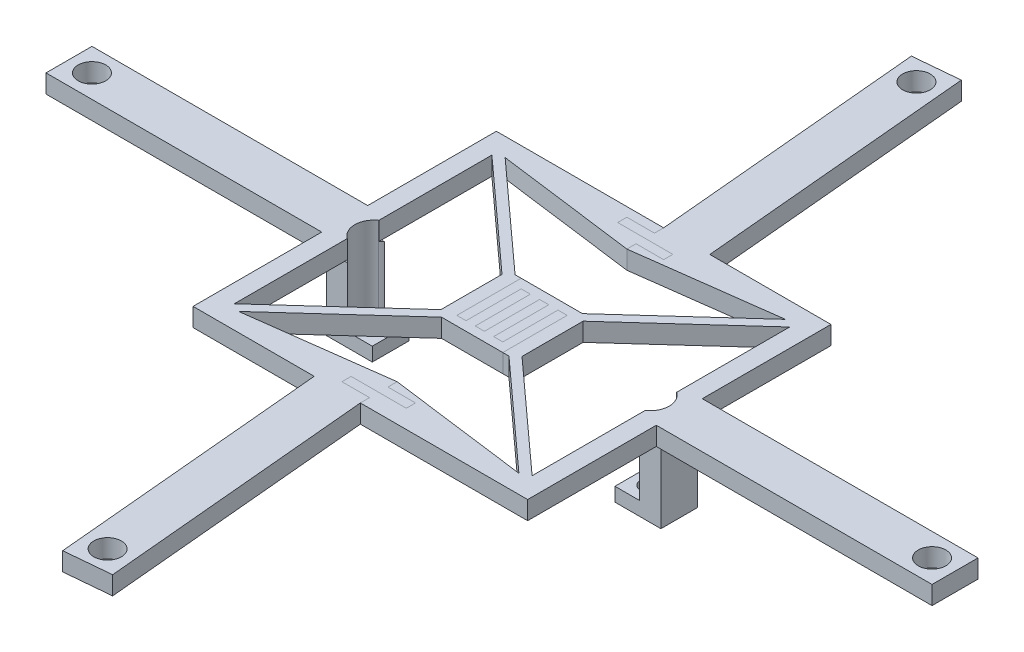
from build123d import *

# Parameters (mm, degrees)
SKETCH1_W           = 36.4
SKETCH1_H           = 33
BOSS_EXTRUDE1_DEPTH = 2
SKETCH2_W           = 5
SKETCH2_H           = 4
BOSS_EXTRUDE2_DEPTH = 8
SKETCH4_R           = 1
CUT_EXTRUDE2_DEPTH  = 27.162759793
CUT_EXTRUDE1_DEPTH  = 8.5
SKETCH5_W           = 2.5
SKETCH5_H           = 2
BOSS_EXTRUDE3_DEPTH = 30
SKETCH6_W           = 2.5
SKETCH6_H           = 2
BOSS_EXTRUDE4_DEPTH = 30
SKETCH11_R          = 1.5
CUT_EXTRUDE3_DEPTH  = 52.918108594
SKETCH10_R          = 1.5
BOSS_EXTRUDE5_DEPTH = 2
SPLIT2_START        = -16.5
SPLIT2_DEPTH        = 58.9999999
SPLIT2_START_2      = 16.5
SPLIT2_2_OUTLINE_W  = 6
SPLIT2_2_OUTLINE_H  = 2
SPLIT2_2_DEPTH      = 30.113981094
SPLIT2_START_3      = -3
SPLIT2_3_OUTLINE_W  = 1
SPLIT2_3_OUTLINE_H  = 2
SPLIT2_3_DEPTH      = 7
SPLIT2_START_4      = 3
SPLIT2_4_OUTLINE_W  = 3
SPLIT2_4_OUTLINE_H  = 2
SPLIT2_4_DEPTH      = 11.5
SPLIT2_START_5      = -14.5
SPLIT2_5_OUTLINE_W  = 6
SPLIT2_5_OUTLINE_H  = 2
SPLIT2_5_DEPTH      = 1
SPLIT2_6_OUTLINE_W  = 3
SPLIT2_6_OUTLINE_H  = 2
SPLIT2_6_DEPTH      = 1
SPLIT2_START_6      = -13.5
SPLIT2_7_OUTLINE_W  = 3
SPLIT2_7_OUTLINE_H  = 2
SPLIT2_7_DEPTH      = 1
SPLIT2_START_7      = 13.5
SPLIT2_8_OUTLINE_W  = 3
SPLIT2_8_OUTLINE_H  = 2
SPLIT2_8_DEPTH      = 1
SPLIT2_START_8      = 15.5
SPLIT2_9_OUTLINE_W  = 3
SPLIT2_9_OUTLINE_H  = 2
SPLIT2_9_DEPTH      = 1
SPLIT2_10_OUTLINE_W = 1
SPLIT2_10_OUTLINE_H = 2
SPLIT2_10_DEPTH     = 1
SPLIT2_11_OUTLINE_R = 1.5
SPLIT2_11_DEPTH     = 2
SPLIT2_START_9      = -8
SPLIT2_12_DEPTH     = 8
SPLIT2_13_OUTLINE_R = 1
SPLIT2_13_DEPTH     = 1.5


# Read off the part's stored shape, not the designer's step: Split2
with BuildPart() as part:
    # Sketch1 → Boss-Extrude1 (new body)
    with BuildSketch(Plane(origin=(0, 0, 0), x_dir=(1, 0, 0), z_dir=(0, 1, 0))):
        Rectangle(SKETCH1_W, SKETCH1_H)
        Polygon((3.667695956, -4), (15.249514138, -14.5), (0, -12.5), (-15.249514138, -14.5), (-3.667695956, -4), align=None, mode=Mode.SUBTRACT)
        Polygon((-4.412121212, -3.325108971), (-16.2, -14.011922158), (-16.2, 14.011922158), (-4.412121212, 3.325108971), align=None, mode=Mode.SUBTRACT)
        Polygon((-3.667695956, 4), (-15.249514138, 14.5), (0, 12.5), (15.249514138, 14.5), (3.667695956, 4), align=None, mode=Mode.SUBTRACT)
        Polygon((4.412121212, 3.325108971), (16.2, 14.011922158), (16.2, -14.011922158), (4.412121212, -3.325108971), align=None, mode=Mode.SUBTRACT)
    extrude(amount=BOSS_EXTRUDE1_DEPTH)

    # Sketch2 → Boss-Extrude2 (add)
    with BuildSketch(Plane.XZ):
        with Locations((15.7, 0)):
            Rectangle(SKETCH2_W, SKETCH2_H)
        with Locations((-15.7, 0)):
            Rectangle(SKETCH2_W, SKETCH2_H)
    extrude(amount=BOSS_EXTRUDE2_DEPTH)

    # Sketch4 → Cut-Extrude2 (cut, through all)
    with BuildSketch(Plane(origin=(0, 1, 0), x_dir=(1, 0, 0), z_dir=(0, 1, 0))):
        with Locations(Location((15, 0, 0), (0, 0, 270))):
            Circle(SKETCH4_R)
        with Locations(Location((-15, 0, 0), (0, 0, 270))):
            Circle(SKETCH4_R)
    extrude(amount=-CUT_EXTRUDE2_DEPTH, mode=Mode.SUBTRACT)

    # Sketch3 → Cut-Extrude1 (cut)
    with BuildSketch(Plane(origin=(0, 2, 0), x_dir=(1, 0, 0), z_dir=(0, 1, 0))):
        with BuildLine():
            Line((15, 4.124318125), (15, 4.257967602))
            Line((15, 4.257967602), (10.3221916, 4.257967602))
            Line((10.3221916, 4.257967602), (10.3221916, -5.239749404))
            Line((10.3221916, -5.239749404), (15, -5.239749404))
            Line((15, -5.239749404), (15, -4.124318125))
            ThreePointArc((15, -4.124318125), (15.326601634, -2.763090306), (16.235294118, -1.69824864))
            ThreePointArc((16.235294118, -1.69824864), (17.1, 0), (16.235294118, 1.69824864))
            ThreePointArc((16.235294118, 1.69824864), (15.326601634, 2.763090306), (15, 4.124318125))
        make_face()
        with BuildLine():
            Line((-10.3221916, -5.239749404), (-15, -5.239749404))
            Line((-15, -5.239749404), (-15, -4.124318125))
            ThreePointArc((-15, -4.124318125), (-15.326601634, -2.763090306), (-16.235294118, -1.69824864))
            ThreePointArc((-16.235294118, -1.69824864), (-17.1, 0), (-16.235294118, 1.69824864))
            ThreePointArc((-16.235294118, 1.69824864), (-15.326601634, 2.763090306), (-15, 4.124318125))
            Line((-15, 4.124318125), (-15, 4.257967602))
            Line((-15, 4.257967602), (-10.3221916, 4.257967602))
            Line((-10.3221916, 4.257967602), (-10.3221916, -5.239749404))
        make_face()
    extrude(amount=-CUT_EXTRUDE1_DEPTH, mode=Mode.SUBTRACT)

    # Sketch5 → Boss-Extrude3 (add)
    with BuildSketch(Plane.ZY.offset(18.2)):
        with Locations((1.25, 1)):
            Rectangle(SKETCH5_W, SKETCH5_H)
        with Locations((-1.25, 1)):
            Rectangle(SKETCH5_W, SKETCH5_H)
    extrude(amount=BOSS_EXTRUDE3_DEPTH)

    # Sketch6 → Boss-Extrude4 (add)
    with BuildSketch(Plane(origin=(18.2, 0, 0), x_dir=(0, 0, -1), z_dir=(1, 0, 0))):
        with Locations((-1.25, 1)):
            Rectangle(SKETCH6_W, SKETCH6_H)
        with Locations((1.25, 1)):
            Rectangle(SKETCH6_W, SKETCH6_H)
    extrude(amount=BOSS_EXTRUDE4_DEPTH)

    # Sketch11 → Cut-Extrude3 (cut, through all)
    with BuildSketch(Plane(origin=(0, 2, 0), x_dir=(1, 0, 0), z_dir=(0, 1, 0))):
        with Locations(Location((-45.7, 0, 0), (0, 0, 270))):
            Circle(SKETCH11_R)
        with Locations(Location((45.7, 0, 0), (0, 0, 270))):
            Circle(SKETCH11_R)
    extrude(amount=-CUT_EXTRUDE3_DEPTH, mode=Mode.SUBTRACT)

    # Sketch10 → Boss-Extrude5 (add)
    # profile 1 of 2: a face of its own
    with BuildSketch(Plane(origin=(0, 2, 0), x_dir=(1, 0, 0), z_dir=(0, 1, 0))):
        Polygon((0, -16.5), (-5.02079011, -16.5), (-2.27177232, -46.613981094), (2.707523657, -46.15943564), align=None)
        with Locations(Location((0, -44, 0), (0, 0, 270))):
            Circle(SKETCH10_R, mode=Mode.SUBTRACT)
    # profile 2 of 2: a face of its own
    with BuildSketch(Plane(origin=(0, 2, 0), x_dir=(1, 0, 0), z_dir=(0, 1, 0))):
        Polygon((0, 16.5), (5.02079011, 16.5), (2.27177232, 46.613981094), (-2.707523657, 46.15943564), align=None)
        with Locations(Location((0, 44, 0), (0, 0, 270))):
            Circle(SKETCH10_R, mode=Mode.SUBTRACT)
    extrude(amount=-BOSS_EXTRUDE5_DEPTH)

    # Split2 outline → Split2 (cut)
    with BuildSketch(Plane.XY.offset(SPLIT2_START)):
        Polygon((-4.412121212, 0), (-3, 0), (-3, 2), (-48.2, 2), (-48.2, 0), (-18.2, 0), (-18.2, -6.5), (-50, -6.5), (-50, -10), (-4.412121212, -10), align=None)
    extrude(amount=SPLIT2_DEPTH, mode=Mode.SUBTRACT)

    # Split2 2 outline → Split2 2 (cut)
    with BuildSketch(Plane.XY.offset(SPLIT2_START_2)):
        with Locations((0, 1)):
            Rectangle(SPLIT2_2_OUTLINE_W, SPLIT2_2_OUTLINE_H)
    extrude(amount=SPLIT2_2_DEPTH, mode=Mode.SUBTRACT)

    # Split2 3 outline → Split2 3 (cut)
    with BuildSketch(Plane.XY.offset(SPLIT2_START_3)):
        with Locations((0.5, 1)):
            Rectangle(SPLIT2_3_OUTLINE_W, SPLIT2_3_OUTLINE_H)
        with Locations((-1.5, 1)):
            Rectangle(SPLIT2_3_OUTLINE_W, SPLIT2_3_OUTLINE_H)
        with Locations((2.5, 1)):
            Rectangle(SPLIT2_3_OUTLINE_W, SPLIT2_3_OUTLINE_H)
    extrude(amount=SPLIT2_3_DEPTH, mode=Mode.SUBTRACT)

    # Split2 4 outline → Split2 4 (cut)
    with BuildSketch(Plane.XY.offset(SPLIT2_START_4)):
        with Locations((-1.5, 1)):
            Rectangle(SPLIT2_4_OUTLINE_W, SPLIT2_4_OUTLINE_H)
    extrude(amount=SPLIT2_4_DEPTH, mode=Mode.SUBTRACT)

    # Split2 5 outline → Split2 5 (cut)
    with BuildSketch(Plane.XY.offset(SPLIT2_START_5)):
        with Locations((0, 1)):
            Rectangle(SPLIT2_5_OUTLINE_W, SPLIT2_5_OUTLINE_H)
    extrude(amount=SPLIT2_5_DEPTH, mode=Mode.SUBTRACT)

    # Split2 6 outline → Split2 6 (cut)
    with BuildSketch(Plane.XY.offset(SPLIT2_START)):
        with Locations((-1.5, 1)):
            Rectangle(SPLIT2_6_OUTLINE_W, SPLIT2_6_OUTLINE_H)
    extrude(amount=SPLIT2_6_DEPTH, mode=Mode.SUBTRACT)

    # Split2 7 outline → Split2 7 (cut)
    with BuildSketch(Plane.XY.offset(SPLIT2_START_6)):
        with Locations((-1.5, 1)):
            Rectangle(SPLIT2_7_OUTLINE_W, SPLIT2_7_OUTLINE_H)
    extrude(amount=SPLIT2_7_DEPTH, mode=Mode.SUBTRACT)

    # Split2 8 outline → Split2 8 (cut)
    with BuildSketch(Plane.XY.offset(SPLIT2_START_7)):
        with Locations((1.5, 1)):
            Rectangle(SPLIT2_8_OUTLINE_W, SPLIT2_8_OUTLINE_H)
    extrude(amount=SPLIT2_8_DEPTH, mode=Mode.SUBTRACT)

    # Split2 9 outline → Split2 9 (cut)
    with BuildSketch(Plane.XY.offset(SPLIT2_START_8)):
        with Locations((-1.5, 1)):
            Rectangle(SPLIT2_9_OUTLINE_W, SPLIT2_9_OUTLINE_H)
    extrude(amount=SPLIT2_9_DEPTH, mode=Mode.SUBTRACT)

    # Split2 10 outline → Split2 10 (cut)
    with BuildSketch(Plane.XY.offset(SPLIT2_START_4)):
        with Locations((1.5, 1)):
            Rectangle(SPLIT2_10_OUTLINE_W, SPLIT2_10_OUTLINE_H)
    extrude(amount=SPLIT2_10_DEPTH, mode=Mode.SUBTRACT)


with BuildPart() as body_2:
    # Split2 11 outline → Split2 11 (new body)
    with BuildSketch(Plane(origin=(0, 0, 0), x_dir=(1, 0, 0), z_dir=(0, 1, 0))):
        Polygon((3, -4), (3, 3), (2, 3), (2, -3), (1, -3), (1, 3), (0, 3), (0, -3), (-1, -3), (-1, 3), (-2, 3), (-2, -3), (-3, -3), (-3, 4), (-3.667695956, 4), (-15.249514138, 14.5), (0, 12.5), (0, 13.5), (3, 13.5), (3, 14.5), (-3, 14.5), (-3, 15.5), (0, 15.5), (0, 16.5), (-18.2, 16.5), (-18.2, 2.5), (-48.2, 2.5), (-48.2, -2.5), (-18.2, -2.5), (-18.2, -16.5), (-5.02079011, -16.5), (-2.27177232, -46.613981094), (2.707523657, -46.15943564), (0, -16.5), (0, -15.5), (-3, -15.5), (-3, -14.5), (3, -14.5), (3, -13.5), (0, -13.5), (0, -12.5), (-15.249514138, -14.5), (-3.667695956, -4), align=None)
        with BuildLine():
            Line((-4.412121212, -3.325108971), (-16.2, -14.011922158))
            Line((-16.2, -14.011922158), (-16.2, -1.724318125))
            ThreePointArc((-16.2, -1.724318125), (-16.217599397, -1.711218855), (-16.235294118, -1.69824864))
            ThreePointArc((-16.235294118, -1.69824864), (-17.1, 0), (-16.235294118, 1.69824864))
            ThreePointArc((-16.235294118, 1.69824864), (-16.217599397, 1.711218855), (-16.2, 1.724318125))
            Line((-16.2, 1.724318125), (-16.2, 14.011922158))
            Line((-16.2, 14.011922158), (-4.412121212, 3.325108971))
            Line((-4.412121212, 3.325108971), (-4.412121212, -3.325108971))
        make_face(mode=Mode.SUBTRACT)
        with Locations((0, -44)):
            Circle(SPLIT2_11_OUTLINE_R, mode=Mode.SUBTRACT)
        with Locations((-45.7, 0)):
            Circle(SPLIT2_11_OUTLINE_R, mode=Mode.SUBTRACT)
    extrude(amount=SPLIT2_11_DEPTH)

    # Split2 12 outline → Split2 12 (add)
    with BuildSketch(Plane(origin=(0, 0, 0), x_dir=(1, 0, 0), z_dir=(0, 1, 0)).offset(SPLIT2_START_9)):
        with BuildLine():
            ThreePointArc((-15.881681681, -2), (-16.052634418, -1.842264819), (-16.235294118, -1.69824864))
            ThreePointArc((-16.235294118, -1.69824864), (-17.1, 0), (-16.235294118, 1.69824864))
            ThreePointArc((-16.235294118, 1.69824864), (-16.052634418, 1.842264819), (-15.881681681, 2))
            Line((-15.881681681, 2), (-18.2, 2))
            Line((-18.2, 2), (-18.2, -2))
            Line((-18.2, -2), (-15.881681681, -2))
        make_face()
    extrude(amount=SPLIT2_12_DEPTH)

    # Split2 13 outline → Split2 13 (add)
    with BuildSketch(Plane(origin=(0, 0, 0), x_dir=(1, 0, 0), z_dir=(0, 1, 0)).offset(SPLIT2_START_9)):
        with BuildLine():
            Line((-15.881681681, -2), (-13.2, -2))
            Line((-13.2, -2), (-13.2, 2))
            Line((-13.2, 2), (-15.881681681, 2))
            ThreePointArc((-15.881681681, 2), (-16.052634418, 1.842264819), (-16.235294118, 1.69824864))
            ThreePointArc((-16.235294118, 1.69824864), (-17.1, 0), (-16.235294118, -1.69824864))
            ThreePointArc((-16.235294118, -1.69824864), (-16.052634418, -1.842264819), (-15.881681681, -2))
        make_face()
        with Locations((-15, 0)):
            Circle(SPLIT2_13_OUTLINE_R, mode=Mode.SUBTRACT)
    extrude(amount=SPLIT2_13_DEPTH)


solid = Compound([part.part, body_2.part])
